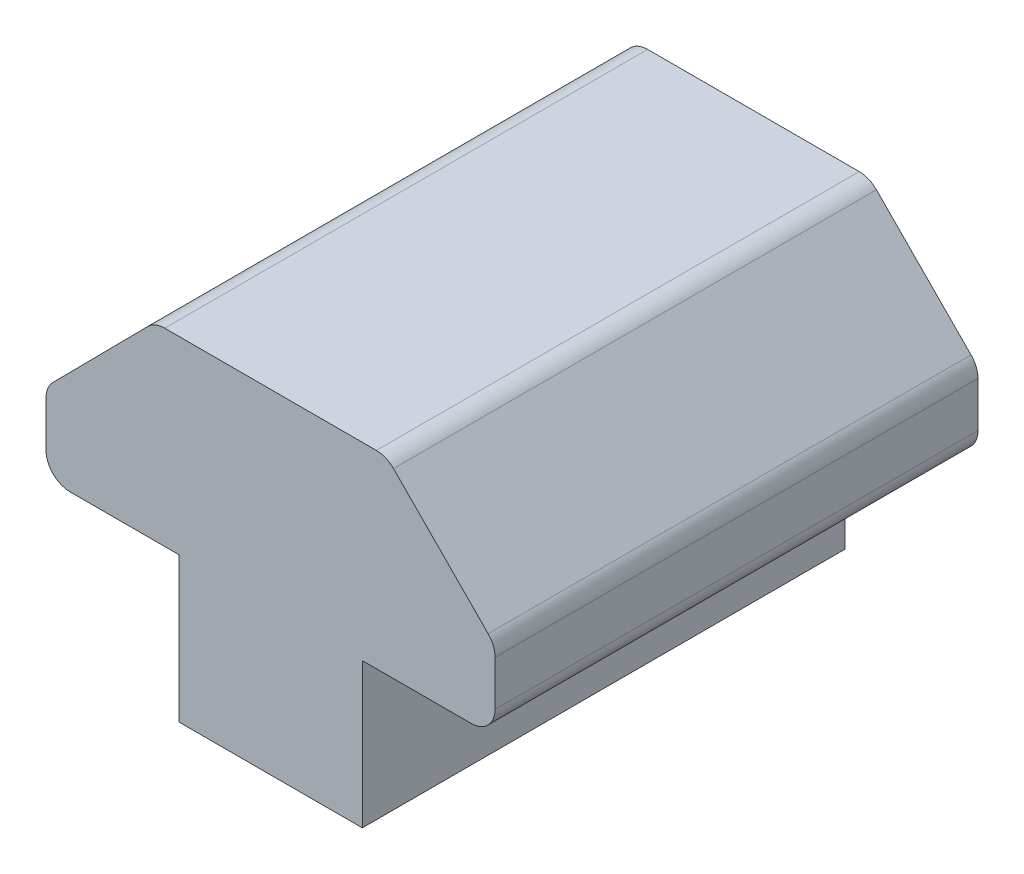
from build123d import *

# Parameters (mm, degrees)
BOSS_EXTRUDE1_DEPTH = 20
FILLET1_R           = 1


with BuildPart() as part:
    # Sketch1 → Boss-Extrude1 (new body)
    with BuildSketch(Plane.XY):
        Polygon((3.8, 0), (-3.8, 0), (-3.8, 6), (-9.3, 6), (-9.3, 9.28), (-4.8, 13.830824101), (4.8, 13.830824101), (9.3, 9.28), (9.3, 6), (3.8, 6), align=None)
    extrude(amount=BOSS_EXTRUDE1_DEPTH)

    # Fillet1
    fillet1_edges = [part.edges().sort_by_distance(p)[0] for p in [
        (9.3, 6, 10),
        (-9.3, 6, 10),
        (-9.3, 9.28, 10),
        (9.3, 9.28, 10),
        (-4.8, 13.830824101, 10),
        (4.8, 13.830824101, 10),
    ]]
    fillet(fillet1_edges, radius=FILLET1_R)


solid = part.part
